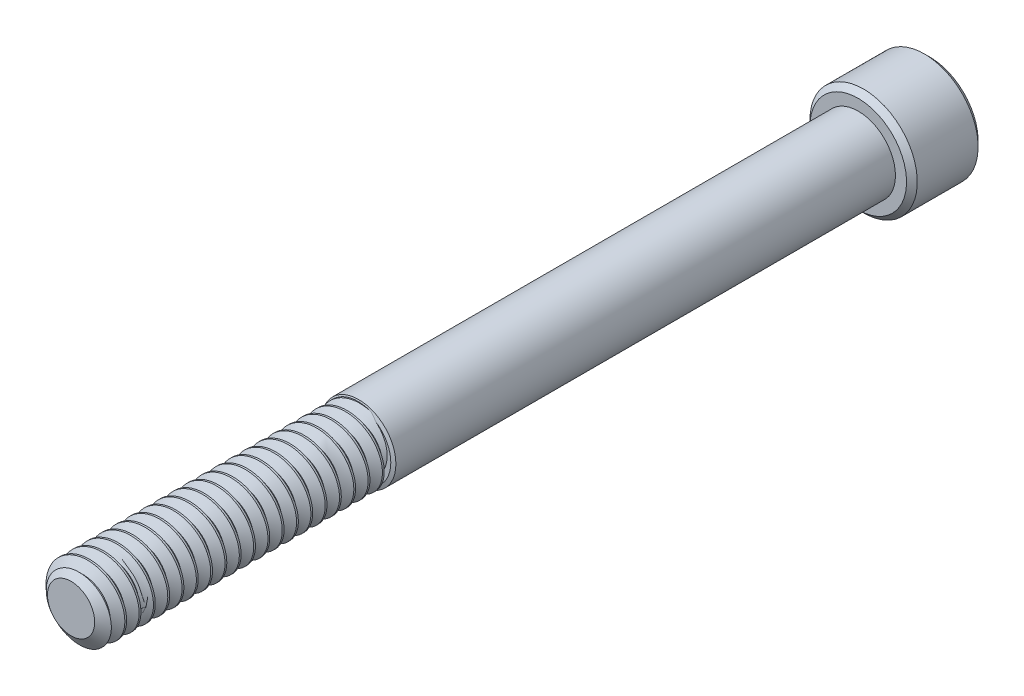
from build123d import *

# Parameters (mm, degrees)
SKETCH1_R          = 3.175
EXTRUDE1_DEPTH     = 69.85
CUT_SWEEP1_PITCH   = 1.27
SKETCH6_R          = 4.7625
EXTRUDE2_DEPTH     = 6.35
CUT_EXTRUDE1_DEPTH = 3.571875
CHAMFER1_SIZE      = 0.47625


with BuildPart() as part:
    # Sketch1 → Extrude1 (new body)
    with BuildSketch(Plane.XY):
        Circle(SKETCH1_R)
    extrude(amount=-EXTRUDE1_DEPTH)

    # Cut-Sweep1: the profile of Sketch3 profile screwed along a right-hand helix of 56 turns, 6 arcs to a turn; built about Z, then put on its axis
    cut_sweep1_z = Axis((0, 0, 0), (0, 0, 1))
    cut_sweep1_corners = [(3.1753, 0, -1.111423205), (2.350110803, 0, -0.635), (2.350110803, 0, -0.47625), (3.1753, 0, 0.000173205)]
    with BuildLine(mode=Mode.PRIVATE) as cut_sweep1_profile:
        Line(cut_sweep1_corners[0], cut_sweep1_corners[1])
        Line(cut_sweep1_corners[1], cut_sweep1_corners[2])
        Line(cut_sweep1_corners[2], cut_sweep1_corners[3])
        Line(cut_sweep1_corners[3], cut_sweep1_corners[0])
    cut_sweep1_cap = Face(cut_sweep1_profile.wire())
    cut_sweep1_turn_angles = [0, 30, 60, 90, 120, 150, 180, 210, 240, 270, 300, 330, 360, 390, 420, 450, 480, 510, 540, 570, 600, 630, 660, 690, 720]
    cut_sweep1_turn_weights = [1, 0.8660254037844387, 1, 0.8660254037844387, 1, 0.8660254037844387, 1, 0.8660254037844387, 1, 0.8660254037844387, 1, 0.8660254037844387, 1, 0.8660254037844387, 1, 0.8660254037844387, 1, 0.8660254037844387, 1, 0.8660254037844387, 1, 0.8660254037844387, 1, 0.8660254037844387, 1]
    cut_sweep1_turn_rails = [Edge.make_bspline([Vector(p[0], p[1], 0).rotate(cut_sweep1_z, cut_sweep1_turn_angles[k]) / cut_sweep1_turn_weights[k] + Vector(0, 0, p[2] + CUT_SWEEP1_PITCH * cut_sweep1_turn_angles[k] / 360) for k in range(25)], [0, 0, 0, 1, 1, 2, 2, 3, 3, 4, 4, 5, 5, 6, 6, 7, 7, 8, 8, 9, 9, 10, 10, 11, 11, 12, 12, 12], 2, cut_sweep1_turn_weights) for p in cut_sweep1_corners]
    cut_sweep1_turn_sides = [Face.make_surface_from_curves(cut_sweep1_turn_rails[p[0]], cut_sweep1_turn_rails[p[1]]) for p in [(0, 1), (1, 2), (2, 3), (3, 0)]]
    cut_sweep1 = Plane(origin=(0, 0, 0), x_dir=(0, 1, 0), z_dir=(0, 0, -1)) * Solid(Shell([*[p.moved(Location((0, 0, 2 * CUT_SWEEP1_PITCH * i))) for i in range(28) for p in cut_sweep1_turn_sides], cut_sweep1_cap, cut_sweep1_cap.rotate(cut_sweep1_z, 20160).moved(Location((0, 0, CUT_SWEEP1_PITCH * 20160 / 360)))]))
    add(cut_sweep1, mode=Mode.SUBTRACT)

    # Sketch4 → Cut-Revolve1 (revolve, cut)
    with BuildSketch(Plane(origin=(0, 0, 0), x_dir=(0, 0, -1), z_dir=(1, 0, 0)), mode=Mode.PRIVATE) as cut_revolve1_sk:
        Polygon((0.755446349, 3.175), (0, 2.096110803), (0, 3.175), align=None)
    revolve(cut_revolve1_sk.sketch.rotate(Axis((0, 0, 0), (0, 0, -1)), 270), axis=Axis((0, 0, 0), (0, 0, -1)), mode=Mode.SUBTRACT)

    # Sketch5 → partially thread (revolve)
    with BuildSketch(Plane(origin=(0, 0, 0), x_dir=(0, 0, -1), z_dir=(1, 0, 0)), mode=Mode.PRIVATE) as partially_thread_sk:
        Polygon((69.85, 3.302), (25.520182971, 3.302), (25.4, 2.9718), (25.4, 0), (69.85, 0), align=None)
    revolve(partially_thread_sk.sketch.rotate(Axis((0, 0, 0), (0, 0, -1)), 270), axis=Axis((0, 0, 0), (0, 0, -1)))

    # Sketch6 → Extrude2 (add)
    with BuildSketch(Plane(origin=(0, 0, -69.85), x_dir=(-1, 0, 0), z_dir=(0, 0, -1))):
        Circle(SKETCH6_R)
    extrude(amount=EXTRUDE2_DEPTH)

    # Sketch7 → Cut-Extrude1 (cut)
    with BuildSketch(Plane(origin=(0, 0, -76.2), x_dir=(-1, 0, 0), z_dir=(0, 0, -1))):
        Polygon((0, 2.749630657), (-2.38125, 1.374815329), (-2.38125, -1.374815329), (0, -2.749630657), (2.38125, -1.374815329), (2.38125, 1.374815329), align=None)
    extrude(amount=-CUT_EXTRUDE1_DEPTH, mode=Mode.SUBTRACT)

    # Cut-Extrude2 cone 1 section (through the dimple's axis) → Cut-Extrude2 (revolve, cut)
    with BuildSketch(Plane(origin=(0, 0, -76.2), x_dir=(0, 1, 0), z_dir=(1, 0, 0))):
        Polygon((0, 0), (2.749630657, 0), (0, 2.749630657), align=None)
    revolve(axis=Axis((0, 0, -76.2), (0, 0, 1)), mode=Mode.SUBTRACT)

    # Chamfer1
    chamfer1_edges = [part.edges().sort_by_distance(p)[0] for p in [
        (4.7625, 0, -69.85),
        (4.7625, 0, -76.2),
    ]]
    chamfer(chamfer1_edges, length=CHAMFER1_SIZE)


solid = part.part
